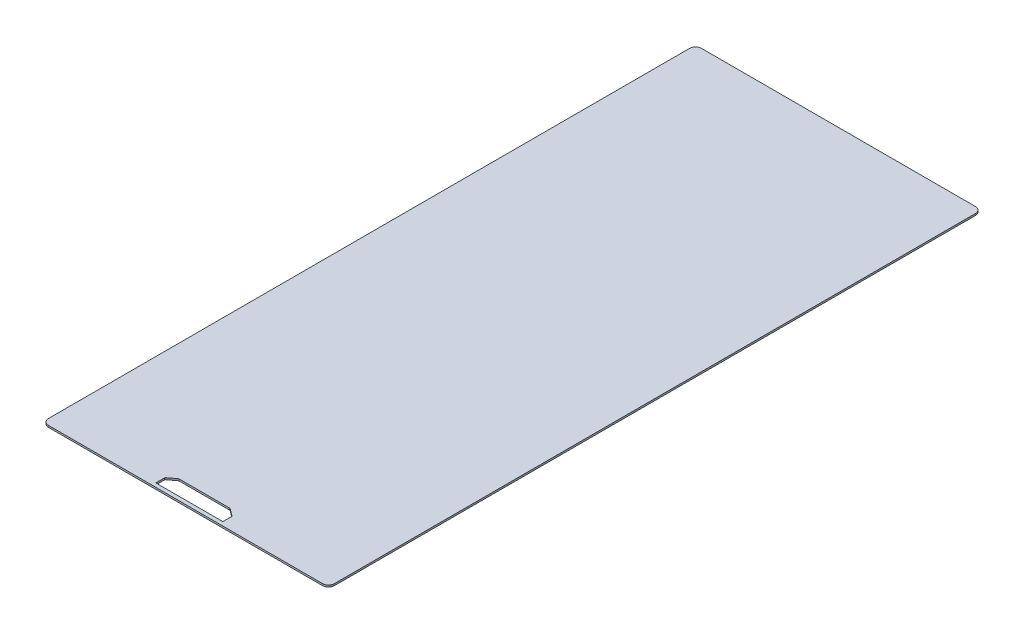
from build123d import *

# Parameters (mm, degrees)
BOSS_EXTRUDE1_DEPTH = 3
CUT_EXTRUDE1_DEPTH  = 603.06602628


with BuildPart() as part:
    # Sketch1 → Boss-Extrude1 (new body)
    with BuildSketch(Plane(origin=(0, 0, 0), x_dir=(1, 0, 0), z_dir=(0, 1, 0))):
        with BuildLine():
            Line((-231.5, -551.5), (231.5, -551.5))
            ThreePointArc((231.5, -551.5), (238.571067812, -548.571067812), (241.5, -541.5))
            Line((241.5, -541.5), (241.5, 541.5))
            ThreePointArc((241.5, 541.5), (238.571067812, 548.571067812), (231.5, 551.5))
            Line((231.5, 551.5), (-231.5, 551.5))
            ThreePointArc((-231.5, 551.5), (-238.571067812, 548.571067812), (-241.5, 541.5))
            Line((-241.5, 541.5), (-241.5, -541.5))
            ThreePointArc((-241.5, -541.5), (-238.571067812, -548.571067812), (-231.5, -551.5))
        make_face()
    extrude(amount=BOSS_EXTRUDE1_DEPTH)

    # Sketch2 → Cut-Extrude1 (cut, through all)
    with BuildSketch(Plane(origin=(0, 3, 0), x_dir=(1, 0, 0), z_dir=(0, 1, 0))):
        with BuildLine():
            Line((-56.625, -545), (56.625, -545))
            Line((56.625, -545), (56.625, -530.749452485))
            ThreePointArc((56.625, -530.749452485), (56.361263845, -529.631810317), (55.625700789, -528.749978268))
            Line((55.625700789, -528.749978268), (43.968277283, -520.000525784))
            ThreePointArc((43.968277283, -520.000525784), (43.258561469, -519.628430315), (42.467576494, -519.5))
            Line((42.467576494, -519.5), (-42.467576494, -519.5))
            ThreePointArc((-42.467576494, -519.5), (-43.258561469, -519.628430315), (-43.968277283, -520.000525784))
            Line((-43.968277283, -520.000525784), (-55.625700789, -528.749978268))
            ThreePointArc((-55.625700789, -528.749978268), (-56.361263845, -529.631810317), (-56.625, -530.749452485))
            Line((-56.625, -530.749452485), (-56.625, -545))
        make_face()
    extrude(amount=-CUT_EXTRUDE1_DEPTH, mode=Mode.SUBTRACT)


solid = part.part
